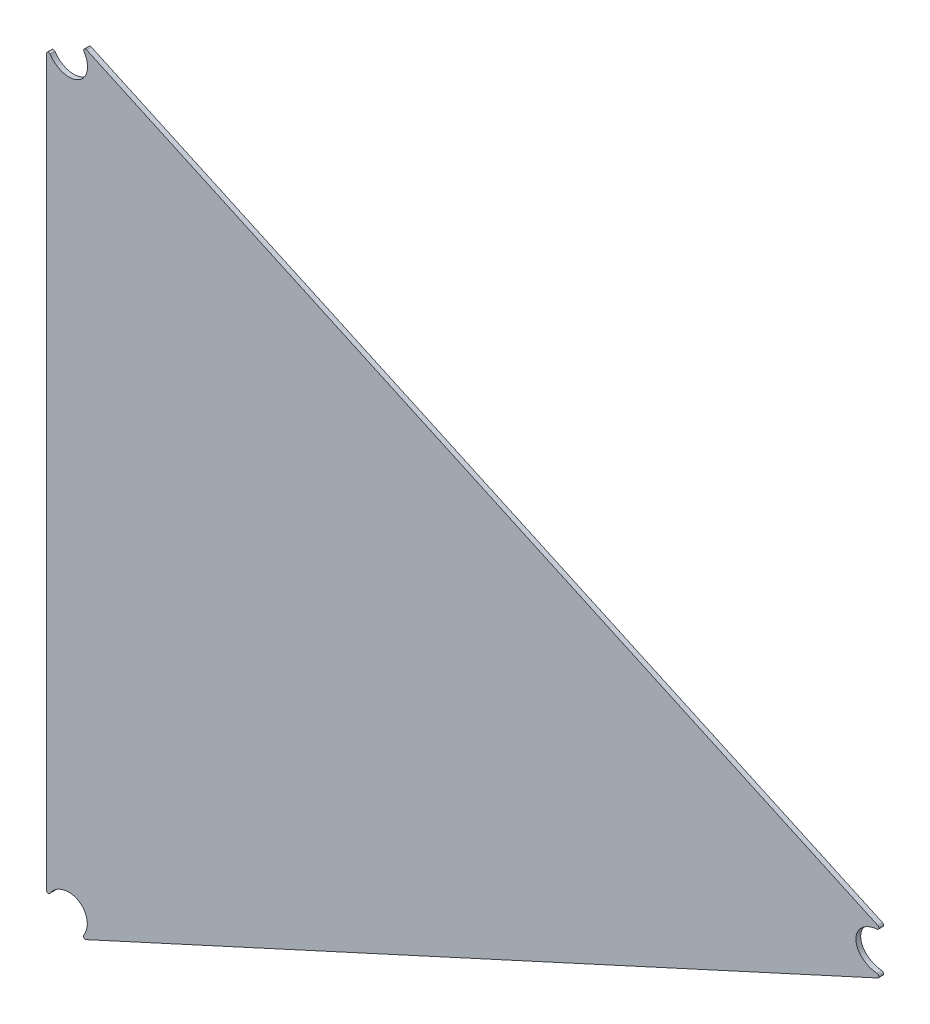
from build123d import *

# Parameters (mm, degrees)
BOSS_EXTRUDE1_DEPTH = 3.175
FILLET1_R           = 1.27


with BuildPart() as part:
    # Sketch2 → Boss-Extrude1 (new body)
    with BuildSketch(Plane.XY):
        with BuildLine():
            add(Edge.make_bspline(
                [(-224.002225489, 237.681676079), (-232.004852581, 227.466830346), (-248.536961255, 229.708235903), (-248.531511338, 247.553045118)],
                knots=[0, 0, 0, 0, 0.379035755, 0.379035755, 0.379035755, 0.379035755], degree=3, weights=[1, 0.494618994, 0.37235293, 0.633201808]))
            Line((-248.531511338, 247.553045118), (-248.68268269, -247.431362977))
            add(Edge.make_bspline(
                [(-248.68268269, -247.431362977), (-248.677234709, -229.592890963), (-232.152010305, -227.358084205), (-224.153396841, -237.567806796)],
                knots=[0.621058297, 0.621058297, 0.621058297, 0.621058297, 1, 1, 1, 1], degree=3, weights=[0.633007703, 0.37241363, 0.494744396, 1]))
            add(Edge.make_bspline(
                [(-224.153396841, -237.567806796), (-219.422565419, -243.606412946), (-220.040878469, -253.31787844), (-230.404432953, -258.064554967)],
                knots=[0, 0, 0, 0, 0.282425472, 0.282425472, 0.282425472, 0.282425472], degree=3, weights=[1, 0.623432704, 0.459569801, 0.50841129]))
            Line((-230.404432953, -258.064554967), (308.83327514, -11.084913444))
            add(Edge.make_bspline(
                [(308.83327514, -11.084913444), (295.43695815, -17.220644529), (285.763127193, -9.203898597), (285.763127193, 0)],
                knots=[0.684854095, 0.684854095, 0.684854095, 0.684854095, 1, 1, 1, 1], degree=3, weights=[0.533951912, 0.424456097, 0.57980546, 1]))
            add(Edge.make_bspline(
                [(285.763127193, 0), (285.763127193, 9.206022551), (295.440494393, 17.223574641), (308.837548746, 11.082955337)],
                knots=[0, 0, 0, 0, 0.315188067, 0.315188067, 0.315188067, 0.315188067], degree=3, weights=[1, 0.579749243, 0.424414534, 0.533995873]))
            Line((308.837548746, 11.082955337), (-230.249394824, 258.176652546))
            add(Edge.make_bspline(
                [(-230.249394824, 258.176652546), (-219.88947652, 253.42812256), (-219.272438092, 243.718949596), (-224.002225489, 237.681676079)],
                knots=[0.717613388, 0.717613388, 0.717613388, 0.717613388, 1, 1, 1, 1], degree=3, weights=[0.508391141, 0.459614898, 0.623484517, 1]))
        make_face()
    extrude(amount=BOSS_EXTRUDE1_DEPTH)

    # Fillet1
    fillet1_edges = [part.edges().sort_by_distance(p)[0] for p in [
        (-230.249394824, 258.176652546, 1.5875),
    ]]
    fillet(fillet1_edges, radius=FILLET1_R)
    fillet1_2_edges = [part.edges().sort_by_distance(p)[0] for p in [
        (-248.531511338, 247.553045118, 1.5875),
    ]]
    fillet(fillet1_2_edges, radius=FILLET1_R)
    fillet1_3_edges = [part.edges().sort_by_distance(p)[0] for p in [
        (-230.404432953, -258.064554967, 1.5875),
    ]]
    fillet(fillet1_3_edges, radius=FILLET1_R)
    fillet1_4_edges = [part.edges().sort_by_distance(p)[0] for p in [
        (308.837548746, 11.082955337, 1.5875),
    ]]
    fillet(fillet1_4_edges, radius=FILLET1_R)
    fillet1_5_edges = [part.edges().sort_by_distance(p)[0] for p in [
        (-248.68268269, -247.431362977, 1.5875),
    ]]
    fillet(fillet1_5_edges, radius=FILLET1_R)
    # the kernel refuses this fillet: 1.27 mm, written as the material it takes off along each edge
    with BuildSketch(Plane(origin=(308.833274988, -11.084913514, -23.853565642), x_dir=(-0.909173978372099, -0.4164164706769535, 0), z_dir=(0, 0, 1))) as fillet1_6_piece_1:
        with BuildLine():
            CenterArc((9.54142609, -1.27), FILLET1_R, 90, 150.734300738)
            Line((8.920573521, -2.377899855), (8.908156469, -2.400057852))
            ThreePointArc((8.908156469, -2.400057852), (4.606653366, -0.645600152), (0, -0.0254))
            Line((0, -0.0254), (0, 0.0254))
            Line((0, 0.0254), (9.54142609, 0.0254))
            Line((9.54142609, 0.0254), (9.54142609, 0))
        make_face()
    extrude(amount=50.882131284, mode=Mode.SUBTRACT)


solid = part.part
